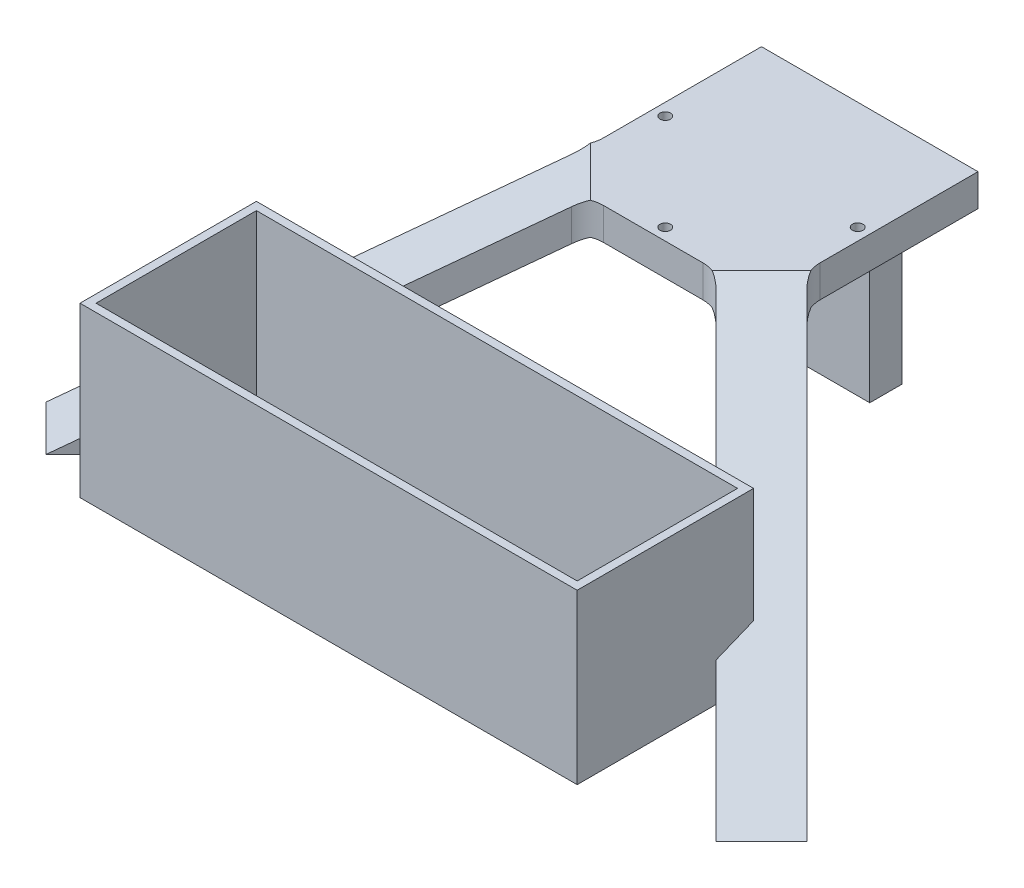
from build123d import *

# Parameters (mm, degrees)
SKETCH2_W                = 67.5
SKETCH2_H                = 67.5
SKETCH2_R                = 1.65
BOSS_EXTRUDE3_DEPTH      = 10
BOSS_EXTRUDE6_DEPTH      = 10
CUT_EXTRUDE2_DEPTH       = 10
CUT_EXTRUDE3_DEPTH       = 10
SKETCH13_W               = 20
SKETCH13_H               = 10
BOSS_EXTRUDE8_DEPTH      = 59.282032303
BOSS_EXTRUDE9_DEPTH      = 77.5
BOSS_EXTRUDE9_DEPTH_BACK = 77.5
SKETCH14_W               = 55
SKETCH14_H               = 52.5
SKETCH15_W               = 150
SKETCH15_H               = 50
CUT_EXTRUDE4_DEPTH       = 50
FILLET1_R                = 10


with BuildPart() as part:
    # Sketch2 → Boss-Extrude3 (new body)
    with BuildSketch(Plane(origin=(0, 0, 0), x_dir=(1, 0, 0), z_dir=(0, 1, 0))):
        Rectangle(SKETCH2_W, SKETCH2_H)
        with Locations(Location((-30, 0, 0), (0, 0, 270))):
            Circle(SKETCH2_R, mode=Mode.SUBTRACT)
        with Locations(Location((30, 0, 0), (0, 0, 270))):
            Circle(SKETCH2_R, mode=Mode.SUBTRACT)
        with Locations(Location((0, -30, 0), (0, 0, 270))):
            Circle(SKETCH2_R, mode=Mode.SUBTRACT)
    extrude(amount=BOSS_EXTRUDE3_DEPTH)


with BuildPart() as body_2:
    # Sketch5 → Boss-Extrude6 (new, symmetric)
    with BuildSketch(Plane(origin=(0, 0, 0), x_dir=(0.7071067811865476, 0, -0.7071067811865476), z_dir=(0.7071067811865476, 0, 0.7071067811865476))):
        Polygon((-37.72970773, 10), (-157.72970773, -59.282032303), (-140.409199654, -59.282032303), (-37.72970773, 0), align=None)
    boss_extrude6 = extrude(amount=BOSS_EXTRUDE6_DEPTH, both=True)


with BuildPart() as part_1:
    add(part.part)

    # Mirror3: Boss-Extrude6 across plane
    add(boss_extrude6.mirror(Plane(origin=(0, 0, 0), x_dir=(0, 0, 1), z_dir=(1, 0, 0))))

    # Sketch11 → Cut-Extrude2 (cut)
    with BuildSketch(Plane(origin=(9.731595226, 23.837442686, 9.731595226), x_dir=(0.9259415151999266, -0.2703581015304675, -0.2637021186227093), z_dir=(0.35355339059327223, 0.8660254037844399, 0.3535533905932725))):
        Polygon((6.552208132, -28.687416212), (23.376309745, -17.873092151), (23.376309745, -36.367082054), align=None)
    extrude(amount=CUT_EXTRUDE2_DEPTH, mode=Mode.SUBTRACT)

    # Sketch12 → Cut-Extrude3 (cut)
    with BuildSketch(Plane(origin=(-9.731595226, 23.837442686, 9.731595226), x_dir=(0.9259415151999266, 0.2703581015304675, 0.2637021186227093), z_dir=(-0.35355339059327223, 0.8660254037844399, 0.3535533905932725))):
        Polygon((-98.300144639, -134.433887296), (-81.476043026, -145.248211357), (-6.552208132, -28.687416212), (-23.376309745, -17.873092151), align=None)
    extrude(amount=CUT_EXTRUDE3_DEPTH, mode=Mode.SUBTRACT)

    # Sketch13 → Boss-Extrude8 (add)
    with BuildSketch(Plane.XZ):
        with Locations((0, -28.75)):
            Rectangle(SKETCH13_W, SKETCH13_H)
    extrude(amount=BOSS_EXTRUDE8_DEPTH)

    add(body_2.part)  # Boss-Extrude9 merges body 2
    # Sketch14 → Boss-Extrude9 (add, two sides: drawn at the far end of the back side and taken through both)
    with BuildSketch(Plane(origin=(0, 0, 0), x_dir=(0, 0, -1), z_dir=(1, 0, 0)).offset(-BOSS_EXTRUDE9_DEPTH_BACK)):
        with Locations((-107.465780691, -23.032032303)):
            Rectangle(SKETCH14_W, SKETCH14_H)
    extrude(amount=BOSS_EXTRUDE9_DEPTH + BOSS_EXTRUDE9_DEPTH_BACK)

    # Sketch15 → Cut-Extrude4 (cut)
    with BuildSketch(Plane(origin=(0, 3.217967697, 0), x_dir=(1, 0, 0), z_dir=(0, 1, 0))):
        with Locations((0, -107.465780691)):
            Rectangle(SKETCH15_W, SKETCH15_H)
    extrude(amount=-CUT_EXTRUDE4_DEPTH, mode=Mode.SUBTRACT)

    # Fillet1
    # the kernel refuses this fillet: 10 mm, written as the material it adds along each edge
    with BuildSketch(Plane(origin=(-19.607864376, 0, 33.75), x_dir=(-0.7071067811865471, 0, 0.7071067811865479), z_dir=(0, 1, 0))) as fillet1_piece_1_section:
        with BuildLine():
            CenterArc((FILLET1_R * 0.414213562373, FILLET1_R), FILLET1_R, 225, 45)
            Line((-FILLET1_R * 0.292893218813, FILLET1_R * 0.292893218813), (0, 0))
            Line((0, 0), (FILLET1_R * 0.414213562373, 0))
        make_face()
    fillet1_piece_1 = extrude(amount=10, mode=Mode.PRIVATE)
    fillet1_piece_1 = split(fillet1_piece_1, bisect_by=Plane(origin=(-17.351540007, 0.866448536, 33.883967569), z_dir=(0.3535533905932724, -0.8660254037844399, -0.3535533905932724)), keep=Keep.TOP, mode=Mode.PRIVATE)
    add(fillet1_piece_1)
    with BuildSketch(Plane(origin=(-19.607864376, -10.355339059, 33.75), x_dir=(-0.7071067811865475, 0, 0.7071067811865475), z_dir=(0, 1, 0))) as fillet1_piece_2_section:
        with BuildLine():
            CenterArc((FILLET1_R * 0.414213562373, FILLET1_R), FILLET1_R, 225, 45)
            Line((-FILLET1_R * 0.292893218813, FILLET1_R * 0.292893218813), (0, 0))
            Line((0, 0), (FILLET1_R * 0.414213562373, 0))
        make_face()
    fillet1_piece_2 = extrude(amount=20.355339059, mode=Mode.PRIVATE)
    fillet1_piece_2 = split(fillet1_piece_2, bisect_by=Plane(origin=(-21.014554375, -1.158148748, 35.180183481), z_dir=(-0.3535533905932724, 0.8660254037844399, 0.3535533905932724)), keep=Keep.TOP, mode=Mode.PRIVATE)
    fillet1_piece_2 = split(fillet1_piece_2, bisect_by=Plane(origin=(-21.217188194, 0, 35.382817301), z_dir=(0, -1, 0)), keep=Keep.TOP, mode=Mode.PRIVATE)
    add(fillet1_piece_2)
    with BuildSketch(Plane(origin=(-19.607864376, 0, 33.75), x_dir=(-0.7071067811865471, 0, 0.7071067811865479), z_dir=(0, 1, 0))) as fillet1_piece_3_section:
        with BuildLine():
            CenterArc((FILLET1_R * 0.414213562373, FILLET1_R), FILLET1_R, 225, 45)
            Line((-FILLET1_R * 0.292893218813, FILLET1_R * 0.292893218813), (0, 0))
            Line((0, 0), (FILLET1_R * 0.414213562373, 0))
        make_face()
    fillet1_piece_3 = extrude(amount=10, mode=Mode.PRIVATE)
    fillet1_piece_3 = split(fillet1_piece_3, bisect_by=Plane(origin=(-20.84268256, 8.638165162, 35.850982283), z_dir=(0.3535533905932724, -0.8660254037844399, -0.3535533905932724)), keep=Keep.TOP, mode=Mode.PRIVATE)
    fillet1_piece_3 = split(fillet1_piece_3, bisect_by=Plane(origin=(-17.780820381, 1.138165162, 32.789120105), z_dir=(-0.3535533905932724, 0.8660254037844399, 0.3535533905932724)), keep=Keep.TOP, mode=Mode.PRIVATE)
    add(fillet1_piece_3)
    with BuildSketch(Plane(origin=(33.75, -10.355339059, 19.607864376), x_dir=(0, 0, -1), z_dir=(0, 1, 0))) as fillet1_piece_4_section:
        with BuildLine():
            CenterArc((FILLET1_R * 0.414213562373, -FILLET1_R), FILLET1_R, 90, 45)
            Line((-FILLET1_R * 0.292893218813, -FILLET1_R * 0.292893218813), (0, 0))
            Line((0, 0), (FILLET1_R * 0.414213562373, 0))
        make_face()
    fillet1_piece_4 = extrude(amount=20.355339059, mode=Mode.PRIVATE)
    fillet1_piece_4 = split(fillet1_piece_4, bisect_by=Plane(origin=(35.382817302, 0, 21.217188197), z_dir=(0, -1, 0)), keep=Keep.TOP, mode=Mode.PRIVATE)
    fillet1_piece_4 = split(fillet1_piece_4, bisect_by=Plane(origin=(35.180183482, -1.15814875, 21.014554377), z_dir=(0.35355339059327234, 0.8660254037844399, 0.35355339059327234)), keep=Keep.TOP, mode=Mode.PRIVATE)
    add(fillet1_piece_4)
    with BuildSketch(Plane(origin=(33.75, 0, 19.607864376), x_dir=(0, 0, -1), z_dir=(0, 1, 0))) as fillet1_piece_5_section:
        with BuildLine():
            CenterArc((FILLET1_R * 0.414213562373, -FILLET1_R), FILLET1_R, 90, 45)
            Line((-FILLET1_R * 0.292893218813, -FILLET1_R * 0.292893218813), (0, 0))
            Line((0, 0), (FILLET1_R * 0.414213562373, 0))
        make_face()
    fillet1_piece_5 = extrude(amount=10, mode=Mode.PRIVATE)
    fillet1_piece_5 = split(fillet1_piece_5, bisect_by=Plane(origin=(33.883967571, 0.866448534, 17.351540009), z_dir=(-0.35355339059327234, -0.8660254037844399, -0.35355339059327234)), keep=Keep.TOP, mode=Mode.PRIVATE)
    add(fillet1_piece_5)
    with BuildSketch(Plane(origin=(33.75, 0, 19.607864376), x_dir=(0, 0, -1), z_dir=(0, 1, 0))) as fillet1_piece_6_section:
        with BuildLine():
            CenterArc((FILLET1_R * 0.414213562373, -FILLET1_R), FILLET1_R, 90, 45)
            Line((-FILLET1_R * 0.292893218813, -FILLET1_R * 0.292893218813), (0, 0))
            Line((0, 0), (FILLET1_R * 0.414213562373, 0))
        make_face()
    fillet1_piece_6 = extrude(amount=10, mode=Mode.PRIVATE)
    fillet1_piece_6 = split(fillet1_piece_6, bisect_by=Plane(origin=(35.850982284, 8.638165162, 20.842682559), z_dir=(-0.3535533905932724, -0.8660254037844399, -0.3535533905932724)), keep=Keep.TOP, mode=Mode.PRIVATE)
    fillet1_piece_6 = split(fillet1_piece_6, bisect_by=Plane(origin=(32.789120106, 1.138165162, 17.780820381), z_dir=(0.35355339059327234, 0.8660254037844399, 0.35355339059327234)), keep=Keep.TOP, mode=Mode.PRIVATE)
    add(fillet1_piece_6)
    with BuildSketch(Plane(origin=(-33.75, 0, 19.607864376), x_dir=(-0.7071067811865479, 0, 0.7071067811865471), z_dir=(0, 1, 0))) as fillet1_piece_7_section:
        with BuildLine():
            CenterArc((FILLET1_R * 0.414213562373, -FILLET1_R), FILLET1_R, 90, 45)
            Line((-FILLET1_R * 0.292893218813, -FILLET1_R * 0.292893218813), (0, 0))
            Line((0, 0), (FILLET1_R * 0.414213562373, 0))
        make_face()
    fillet1_piece_7 = extrude(amount=10, mode=Mode.PRIVATE)
    fillet1_piece_7 = split(fillet1_piece_7, bisect_by=Plane(origin=(-33.883967569, 0.866448536, 17.351540007), z_dir=(0.3535533905932724, -0.8660254037844399, -0.3535533905932724)), keep=Keep.TOP, mode=Mode.PRIVATE)
    add(fillet1_piece_7)
    with BuildSketch(Plane(origin=(-33.75, -10.355339059, 19.607864376), x_dir=(-0.7071067811865475, 0, 0.7071067811865475), z_dir=(0, 1, 0))) as fillet1_piece_8_section:
        with BuildLine():
            CenterArc((FILLET1_R * 0.414213562373, -FILLET1_R), FILLET1_R, 90, 45)
            Line((-FILLET1_R * 0.292893218813, -FILLET1_R * 0.292893218813), (0, 0))
            Line((0, 0), (FILLET1_R * 0.414213562373, 0))
        make_face()
    fillet1_piece_8 = extrude(amount=20.355339059, mode=Mode.PRIVATE)
    fillet1_piece_8 = split(fillet1_piece_8, bisect_by=Plane(origin=(-35.180183481, -1.158148748, 21.014554375), z_dir=(-0.3535533905932724, 0.8660254037844399, 0.3535533905932724)), keep=Keep.TOP, mode=Mode.PRIVATE)
    fillet1_piece_8 = split(fillet1_piece_8, bisect_by=Plane(origin=(-35.382817301, 0, 21.217188194), z_dir=(0, -1, 0)), keep=Keep.TOP, mode=Mode.PRIVATE)
    add(fillet1_piece_8)
    with BuildSketch(Plane(origin=(-33.75, 0, 19.607864376), x_dir=(-0.7071067811865479, 0, 0.7071067811865471), z_dir=(0, 1, 0))) as fillet1_piece_9_section:
        with BuildLine():
            CenterArc((FILLET1_R * 0.414213562373, -FILLET1_R), FILLET1_R, 90, 45)
            Line((-FILLET1_R * 0.292893218813, -FILLET1_R * 0.292893218813), (0, 0))
            Line((0, 0), (FILLET1_R * 0.414213562373, 0))
        make_face()
    fillet1_piece_9 = extrude(amount=10, mode=Mode.PRIVATE)
    fillet1_piece_9 = split(fillet1_piece_9, bisect_by=Plane(origin=(-35.850982283, 8.638165162, 20.84268256), z_dir=(0.3535533905932724, -0.8660254037844399, -0.3535533905932724)), keep=Keep.TOP, mode=Mode.PRIVATE)
    fillet1_piece_9 = split(fillet1_piece_9, bisect_by=Plane(origin=(-32.789120105, 1.138165162, 17.780820381), z_dir=(-0.3535533905932724, 0.8660254037844399, 0.3535533905932724)), keep=Keep.TOP, mode=Mode.PRIVATE)
    add(fillet1_piece_9)
    with BuildSketch(Plane(origin=(19.607864376, -10.355339059, 33.75), x_dir=(-1, 0, 0), z_dir=(0, 1, 0))) as fillet1_piece_10_section:
        with BuildLine():
            CenterArc((FILLET1_R * 0.414213562373, FILLET1_R), FILLET1_R, 225, 45)
            Line((-FILLET1_R * 0.292893218813, FILLET1_R * 0.292893218813), (0, 0))
            Line((0, 0), (FILLET1_R * 0.414213562373, 0))
        make_face()
    fillet1_piece_10 = extrude(amount=20.355339059, mode=Mode.PRIVATE)
    fillet1_piece_10 = split(fillet1_piece_10, bisect_by=Plane(origin=(21.217188197, 0, 35.382817302), z_dir=(0, -1, 0)), keep=Keep.TOP, mode=Mode.PRIVATE)
    fillet1_piece_10 = split(fillet1_piece_10, bisect_by=Plane(origin=(21.014554377, -1.15814875, 35.180183482), z_dir=(0.35355339059327234, 0.8660254037844399, 0.35355339059327234)), keep=Keep.TOP, mode=Mode.PRIVATE)
    add(fillet1_piece_10)
    with BuildSketch(Plane(origin=(19.607864376, 0, 33.75), x_dir=(-1, 0, 0), z_dir=(0, 1, 0))) as fillet1_piece_11_section:
        with BuildLine():
            CenterArc((FILLET1_R * 0.414213562373, FILLET1_R), FILLET1_R, 225, 45)
            Line((-FILLET1_R * 0.292893218813, FILLET1_R * 0.292893218813), (0, 0))
            Line((0, 0), (FILLET1_R * 0.414213562373, 0))
        make_face()
    fillet1_piece_11 = extrude(amount=10, mode=Mode.PRIVATE)
    fillet1_piece_11 = split(fillet1_piece_11, bisect_by=Plane(origin=(17.351540009, 0.866448534, 33.883967571), z_dir=(-0.35355339059327234, -0.8660254037844399, -0.35355339059327234)), keep=Keep.TOP, mode=Mode.PRIVATE)
    add(fillet1_piece_11)
    with BuildSketch(Plane(origin=(19.607864376, 0, 33.75), x_dir=(-1, 0, 0), z_dir=(0, 1, 0))) as fillet1_piece_12_section:
        with BuildLine():
            CenterArc((FILLET1_R * 0.414213562373, FILLET1_R), FILLET1_R, 225, 45)
            Line((-FILLET1_R * 0.292893218813, FILLET1_R * 0.292893218813), (0, 0))
            Line((0, 0), (FILLET1_R * 0.414213562373, 0))
        make_face()
    fillet1_piece_12 = extrude(amount=10, mode=Mode.PRIVATE)
    fillet1_piece_12 = split(fillet1_piece_12, bisect_by=Plane(origin=(20.842682559, 8.638165162, 35.850982284), z_dir=(-0.3535533905932724, -0.8660254037844399, -0.3535533905932724)), keep=Keep.TOP, mode=Mode.PRIVATE)
    fillet1_piece_12 = split(fillet1_piece_12, bisect_by=Plane(origin=(17.780820381, 1.138165162, 32.789120106), z_dir=(0.35355339059327234, 0.8660254037844399, 0.35355339059327234)), keep=Keep.TOP, mode=Mode.PRIVATE)
    add(fillet1_piece_12)


solid = part_1.part
